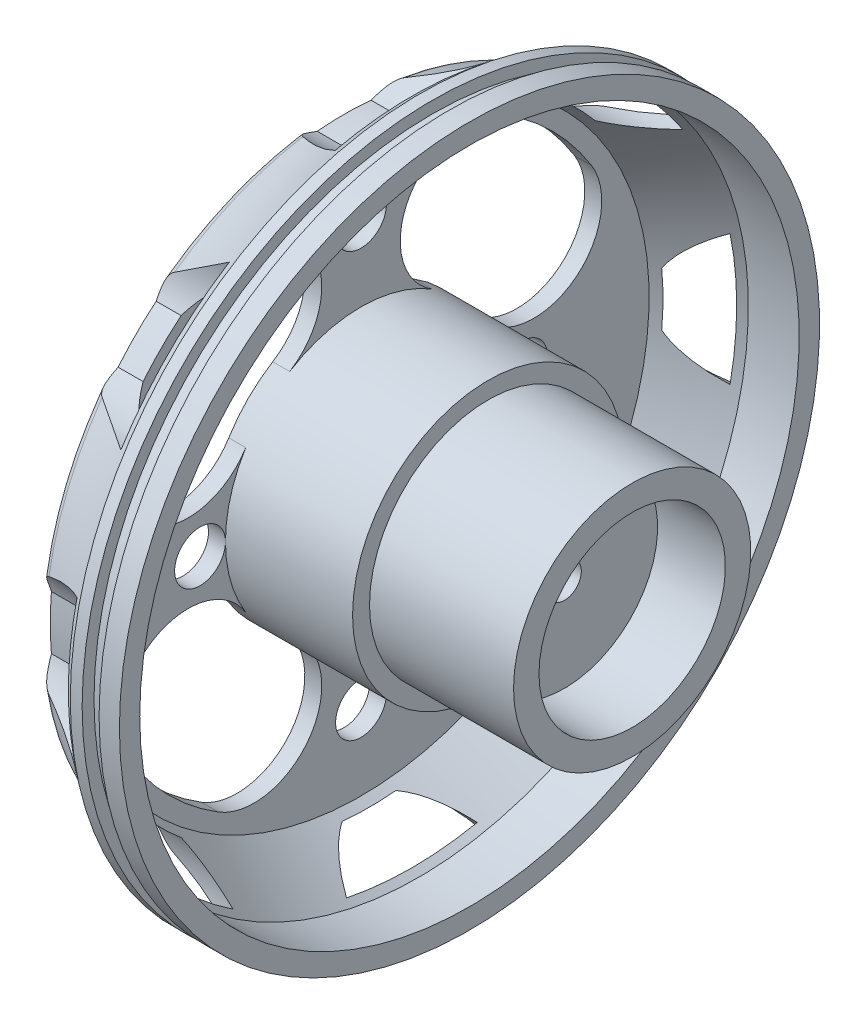
from build123d import *
from build123d.topology import SkipClean

# Parameters (mm, degrees)
FILLET2_R          = 1
CUT_EXTRUDE2_START = -4
CUT_EXTRUDE2_DEPTH = 4
SKETCH4_R          = 1.5
CUT_EXTRUDE3_DEPTH = 34.800398909


# Read off the part's stored shape, not the designer's step: Cut-Extrude2
with BuildPart() as part:
    # Sketch2 → Revolve1 (revolve)
    with BuildSketch(Plane.XY, mode=Mode.PRIVATE) as revolve1_sk:
        with BuildLine():
            Line((0, 5.5), (0, 18))
            ThreePointArc((0, 18), (2.345672943, 19.16676094), (4.5, 20.657528388))
            Line((4.5, 20.657528388), (5.2, 20.657528388))
            Line((5.2, 20.657528388), (5.2, 19.957528388))
            Line((5.2, 19.957528388), (6.2, 19.957528388))
            Line((6.2, 19.957528388), (6.2, 20.657528388))
            Line((6.2, 20.657528388), (7.4, 20.657528388))
            Line((7.4, 20.657528388), (7.4, 19.457528388))
            Line((7.4, 19.457528388), (4.4, 19.457528388))
            Line((4.4, 19.457528388), (1, 17))
            Line((1, 17), (1, 8))
            Line((1, 8), (8.5, 8))
            Line((8.5, 8), (8.5, 7))
            Line((8.5, 7), (17, 7))
            Line((17, 7), (17, 5.5))
            Line((17, 5.5), (13, 5.5))
            Line((13, 5.5), (13, 1))
            Line((13, 1), (4, 1))
            Line((4, 1), (4, 5.5))
            Line((4, 5.5), (0, 5.5))
        make_face()
    revolve(revolve1_sk.sketch.rotate(Axis((0, 0, 0), (1, 0, 0)), 90), axis=Axis((0, 0, 0), (1, 0, 0)))

    # Fillet2
    fillet2_edges = [part.edges().sort_by_distance(p)[0] for p in [
        (0, 0, -18),
    ]]
    fillet(fillet2_edges, radius=FILLET2_R)

    # Cut-Extrude2 outline → Cut-Extrude2 (cut)
    with SkipClean():  # the faces are left unmerged after this step: merging them gives an invalid solid
        with BuildSketch(Plane.ZY.offset(CUT_EXTRUDE2_START)):
            with BuildLine():
                ThreePointArc((6.802671944, 4.20994708), (12.308981457, 2.913584648), (13.605343889, 8.41989416))
                ThreePointArc((13.605343889, 8.41989416), (11.313708499, 11.313708499), (8.41989416, 13.605343889))
                ThreePointArc((8.41989416, 13.605343889), (2.913584648, 12.308981457), (4.20994708, 6.802671944))
                ThreePointArc((4.20994708, 6.802671944), (5.656854249, 5.656854249), (6.802671944, 4.20994708))
            make_face()
            with BuildLine():
                ThreePointArc((-6.802671944, 4.20994708), (-5.656854249, 5.656854249), (-4.20994708, 6.802671944))
                ThreePointArc((-4.20994708, 6.802671944), (-2.913584648, 12.308981457), (-8.41989416, 13.605343889))
                ThreePointArc((-8.41989416, 13.605343889), (-11.313708499, 11.313708499), (-13.605343889, 8.41989416))
                ThreePointArc((-13.605343889, 8.41989416), (-12.308981457, 2.913584648), (-6.802671944, 4.20994708))
            make_face()
            with BuildLine():
                ThreePointArc((13.605343889, -8.41989416), (12.308981457, -2.913584648), (6.802671944, -4.20994708))
                ThreePointArc((6.802671944, -4.20994708), (5.656854249, -5.656854249), (4.20994708, -6.802671944))
                ThreePointArc((4.20994708, -6.802671944), (2.913584648, -12.308981457), (8.41989416, -13.605343889))
                ThreePointArc((8.41989416, -13.605343889), (11.313708499, -11.313708499), (13.605343889, -8.41989416))
            make_face()
            with BuildLine():
                ThreePointArc((-4.20994708, -6.802671944), (-5.656854249, -5.656854249), (-6.802671944, -4.20994708))
                ThreePointArc((-6.802671944, -4.20994708), (-12.308981457, -2.913584648), (-13.605343889, -8.41989416))
                ThreePointArc((-13.605343889, -8.41989416), (-11.313708499, -11.313708499), (-8.41989416, -13.605343889))
                ThreePointArc((-8.41989416, -13.605343889), (-2.913584648, -12.308981457), (-4.20994708, -6.802671944))
            make_face()
            with BuildLine():
                ThreePointArc((17.544876408, 10.904622456), (14.607078405, 14.607078405), (10.904622456, 17.544876408))
                ThreePointArc((10.904622456, 17.544876408), (10.541627405, 15.420100555), (11.087885925, 13.33490525))
                ThreePointArc((11.087885925, 13.33490525), (12.262970937, 12.262970937), (13.334905256, 11.087885922))
                ThreePointArc((13.334905256, 11.087885922), (15.420100556, 10.541627405), (17.544876408, 10.904622456))
            make_face()
            with BuildLine():
                ThreePointArc((1.588882605, 17.269521256), (3.449601448, 18.357713893), (4.695368598, 20.116833568))
                ThreePointArc((4.695368598, 20.116833568), (0, 20.657528388), (-4.695368598, 20.116833568))
                ThreePointArc((-4.695368598, 20.116833568), (-3.449601447, 18.357713892), (-1.588882603, 17.269521255))
                ThreePointArc((-1.588882603, 17.269521255), (0, 17.342459814), (1.588882605, 17.269521256))
            make_face()
            with BuildLine():
                ThreePointArc((20.116833568, -4.695368598), (20.657528388, 0), (20.116833568, 4.695368598))
                ThreePointArc((20.116833568, 4.695368598), (18.357713892, 3.449601447), (17.269521255, 1.588882603))
                ThreePointArc((17.269521255, 1.588882603), (17.342459814, 0), (17.269521258, -1.588882609))
                ThreePointArc((17.269521258, -1.588882609), (18.357713893, -3.449601448), (20.116833568, -4.695368598))
            make_face()
            with BuildLine():
                ThreePointArc((-11.087885924, 13.334905252), (-10.541627405, 15.420100556), (-10.904622456, 17.544876408))
                ThreePointArc((-10.904622456, 17.544876408), (-14.607078405, 14.607078405), (-17.544876408, 10.904622456))
                ThreePointArc((-17.544876408, 10.904622456), (-15.420100555, 10.541627405), (-13.33490525, 11.087885925))
                ThreePointArc((-13.33490525, 11.087885925), (-12.262970937, 12.262970937), (-11.087885924, 13.334905252))
            make_face()
            with BuildLine():
                ThreePointArc((10.904622456, -17.544876408), (14.607078405, -14.607078405), (17.544876408, -10.904622456))
                ThreePointArc((17.544876408, -10.904622456), (15.420100555, -10.541627405), (13.33490525, -11.087885925))
                ThreePointArc((13.33490525, -11.087885925), (12.262970937, -12.262970937), (11.087885922, -13.334905256))
                ThreePointArc((11.087885922, -13.334905256), (10.541627405, -15.420100556), (10.904622456, -17.544876408))
            make_face()
            with BuildLine():
                ThreePointArc((-17.269521256, 1.588882605), (-18.357713893, 3.449601448), (-20.116833568, 4.695368598))
                ThreePointArc((-20.116833568, 4.695368598), (-20.657528388, 0), (-20.116833568, -4.695368598))
                ThreePointArc((-20.116833568, -4.695368598), (-18.357713892, -3.449601447), (-17.269521255, -1.588882603))
                ThreePointArc((-17.269521255, -1.588882603), (-17.342459814, 0), (-17.269521256, 1.588882605))
            make_face()
            with BuildLine():
                ThreePointArc((-4.695368598, -20.116833568), (0, -20.657528388), (4.695368598, -20.116833568))
                ThreePointArc((4.695368598, -20.116833568), (3.449601447, -18.357713892), (1.588882603, -17.269521255))
                ThreePointArc((1.588882603, -17.269521255), (0, -17.342459814), (-1.588882609, -17.269521258))
                ThreePointArc((-1.588882609, -17.269521258), (-3.449601448, -18.357713893), (-4.695368598, -20.116833568))
            make_face()
            with BuildLine():
                ThreePointArc((-13.334905252, -11.087885924), (-15.420100556, -10.541627405), (-17.544876408, -10.904622456))
                ThreePointArc((-17.544876408, -10.904622456), (-14.607078405, -14.607078405), (-10.904622456, -17.544876408))
                ThreePointArc((-10.904622456, -17.544876408), (-10.541627405, -15.420100555), (-11.087885925, -13.33490525))
                ThreePointArc((-11.087885925, -13.33490525), (-12.262970937, -12.262970937), (-13.334905252, -11.087885924))
            make_face()
        extrude(amount=CUT_EXTRUDE2_DEPTH, mode=Mode.SUBTRACT)

    # Sketch4 → Cut-Extrude3 (cut, through all)
    with SkipClean():  # the faces are left unmerged after this step: merging them gives an invalid solid
        with BuildSketch(Plane.ZY):
            with Locations((0, 12.5)):
                Circle(SKETCH4_R)
            with Locations((0, -12.5)):
                Circle(SKETCH4_R)
            with Locations((9.5, 0)):
                Circle(SKETCH4_R)
            with Locations((-9.5, 0)):
                Circle(SKETCH4_R)
        extrude(amount=-CUT_EXTRUDE3_DEPTH, mode=Mode.SUBTRACT)


solid = part.part
